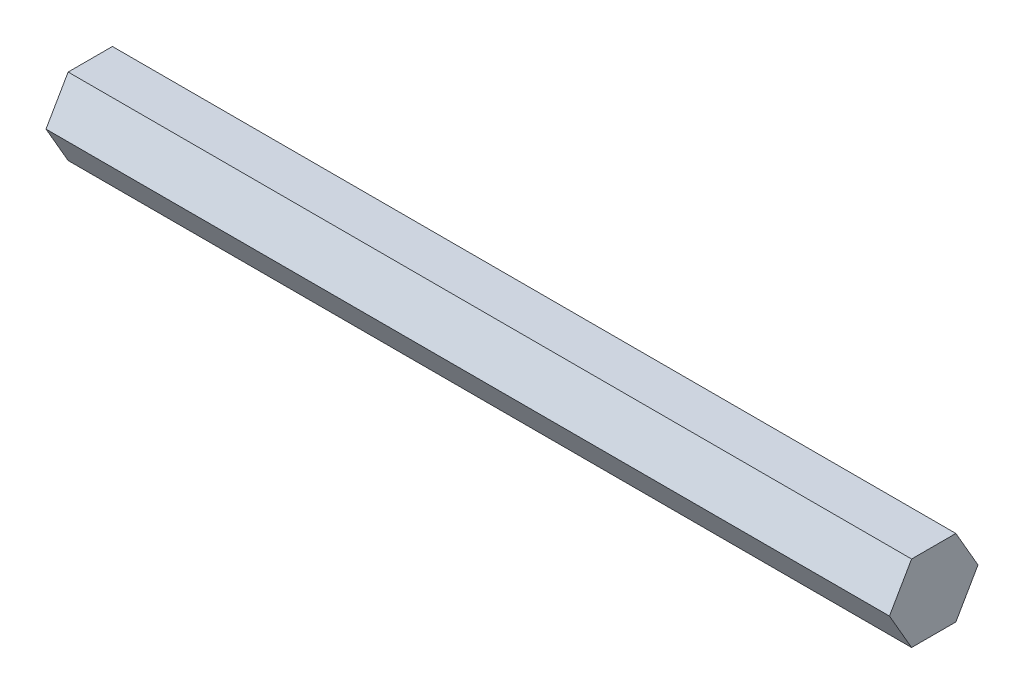
from build123d import *

# Parameters (mm, degrees)
BOSS_EXTRUDE1_DEPTH = 69.85


with BuildPart() as part:
    # Sketch1 → Boss-Extrude1 (new, symmetric)
    with BuildSketch(Plane(origin=(0, 0, 0), x_dir=(0, 0, -1), z_dir=(1, 0, 0))):
        Polygon((7.332348419, 0), (3.666174209, 6.35), (-3.666174209, 6.35), (-7.332348419, 0), (-3.666174209, -6.35), (3.666174209, -6.35), align=None)
    extrude(amount=BOSS_EXTRUDE1_DEPTH, both=True)


solid = part.part
